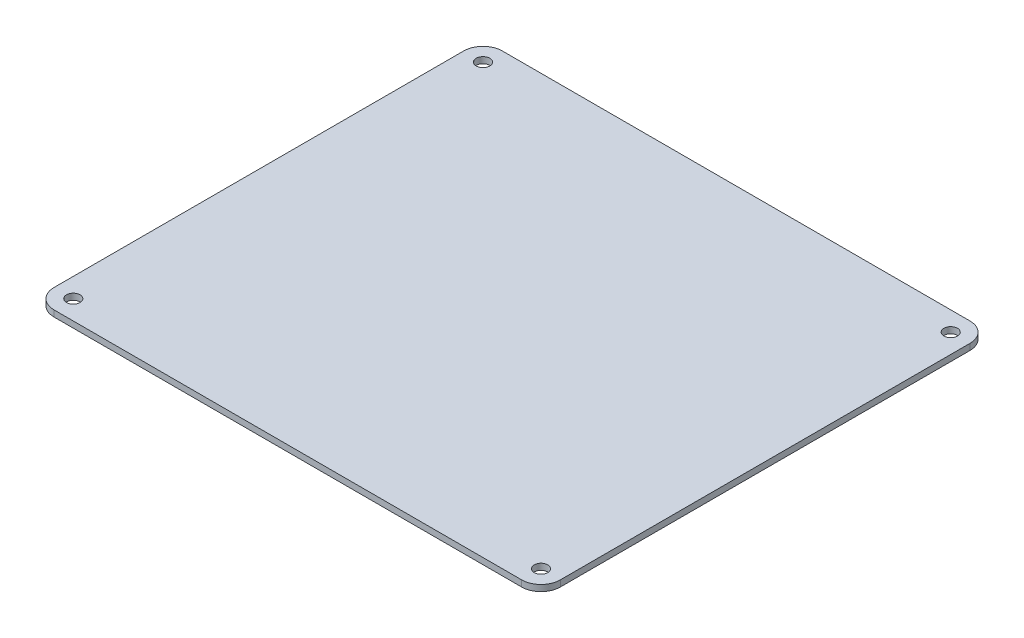
from build123d import *

# Parameters (mm, degrees)
ESQUISSE1_R        = 1.75
BOSS_EXTRU_1_DEPTH = 0.805
ESQUISSE3_R        = 0.225
BOSS_EXTRU_2_DEPTH = 5


with BuildPart() as part:
    # Esquisse1 → Boss.-Extru.1 (new, symmetric)
    with BuildSketch(Plane(origin=(0, 0, 0), x_dir=(1, 0, 0), z_dir=(0, 1, 0))):
        with BuildLine():
            Line((-60.5, 58), (60.5, 58))
            ThreePointArc((60.5, 58), (64.035533906, 56.535533906), (65.5, 53))
            Line((65.5, 53), (65.5, -53))
            ThreePointArc((65.5, -53), (64.035533906, -56.535533906), (60.5, -58))
            Line((60.5, -58), (-60.5, -58))
            ThreePointArc((-60.5, -58), (-64.035533906, -56.535533906), (-65.5, -53))
            Line((-65.5, -53), (-65.5, 53))
            ThreePointArc((-65.5, 53), (-64.035533906, 56.535533906), (-60.5, 58))
        make_face()
        with Locations((-60.5, 53)):
            Circle(ESQUISSE1_R, mode=Mode.SUBTRACT)
        with Locations((60.5, 53)):
            Circle(ESQUISSE1_R, mode=Mode.SUBTRACT)
        with Locations((60.5, -53)):
            Circle(ESQUISSE1_R, mode=Mode.SUBTRACT)
        with Locations((-60.5, -53)):
            Circle(ESQUISSE1_R, mode=Mode.SUBTRACT)
    extrude(amount=BOSS_EXTRU_1_DEPTH, both=True)

    # Esquisse3 → Boss.-Extru.2 (add)
    with BuildSketch(Plane.XZ.offset(0.805)):
        with Locations((23.5, -42)):
            Circle(ESQUISSE3_R)
    extrude(amount=BOSS_EXTRU_2_DEPTH)


solid = part.part
